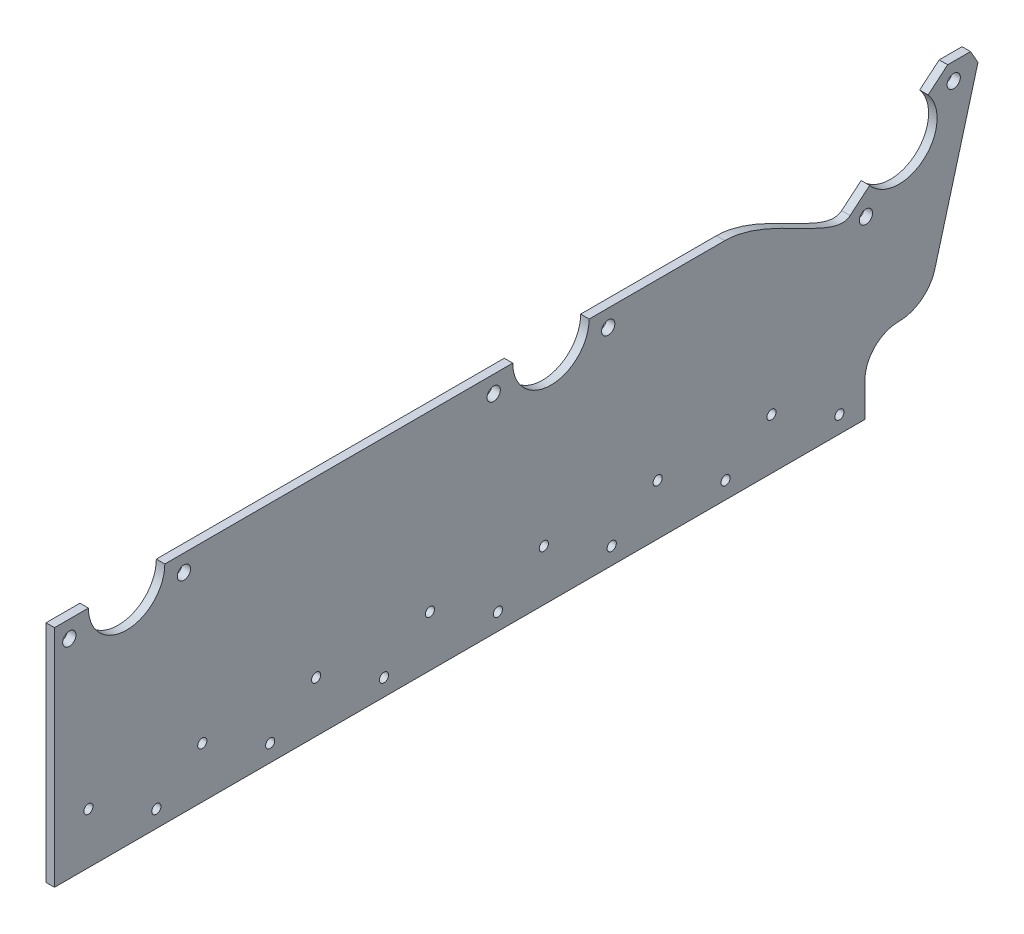
from build123d import *

# Parameters (mm, degrees)
BOSS_EXTRUDE1_DEPTH              = 3.175
F_10_CLEARANCE_HOLE1_D           = 4.9784
CHAMFER1_SIZE                    = 5.08
CHAMFER1_SIZE2                   = 4.134495326
F_1_8_0_135_DIAMETER_HOLE1_D     = 3.429
F_1_8_0_135_DIAMETER_HOLE1_DEPTH = 16.51
F_1_8_0_135_DIAMETER_HOLE1_TIP   = 1.030175531


with BuildPart() as part:
    # Sketch1 → Boss-Extrude1 (new body)
    with BuildSketch(Plane(origin=(0, 0, 0), x_dir=(0, 0, -1), z_dir=(1, 0, 0))):
        with BuildLine():
            Line((-12.7, -12.7), (-315.9125, -12.7))
            Line((-315.9125, -12.7), (-315.9125, 71.4375))
            Line((-315.9125, 71.4375), (-303.2125, 71.4375))
            ThreePointArc((-303.2125, 71.4375), (-288.925, 57.15), (-274.6375, 71.4375))
            Line((-274.6375, 71.4375), (-144.4625, 71.4375))
            ThreePointArc((-144.4625, 71.4375), (-130.175, 57.15), (-115.8875, 71.4375))
            Line((-115.8875, 71.4375), (-65.0875, 71.4375))
            add(Edge.make_bspline(
                [(-18.243165022, 56.129666959), (-24.729007974, 50.68739853), (-48.154166667, 71.4375), (-65.0875, 71.4375)],
                knots=[0, 0, 0, 0, 1, 1, 1, 1], degree=3))
            Line((-18.243165022, 56.129666959), (-10.944859981, 62.253672027))
            ThreePointArc((-10.944859981, 62.253672027), (9.183827973, 60.492640019), (10.944859981, 80.621327973))
            Line((10.944859981, 80.621327973), (18.243165022, 86.745333041))
            Line((18.243165022, 86.745333041), (30.943165022, 86.745333041))
            Line((30.943165022, 86.745333041), (13.473517024, 22.978761859))
            ThreePointArc((13.473517024, 22.978761859), (8.473319986, 15.563076555), (0, 12.7))
            ThreePointArc((0, 12.7), (-8.980256121, 8.980256121), (-12.7, 0))
            Line((-12.7, 0), (-12.7, -12.7))
        make_face()
    extrude(amount=BOSS_EXTRUDE1_DEPTH)

    # #10 Clearance Hole1 (through all)
    with Locations(Plane(origin=(3.175, 0, 0), x_dir=(0, 0, -1), z_dir=(1, 0, 0))):
        with Locations((-310.35625, 65.0875), (-267.49375, 65.0875), (-151.60625, 65.0875), (-108.74375, 65.0875), (-12.33558865, 52.797375826), (20.498991293, 80.348859746)):
            Hole(F_10_CLEARANCE_HOLE1_D / 2)

    # Chamfer1
    chamfer1_edges = [part.edges().sort_by_distance(p)[0] for p in [
        (1.5875, 86.745333041, -30.943165022),
    ]]
    chamfer1_side = [part.faces().sort_by_distance(p)[0] for p in [
        (1.5875, 54.86204745, -22.208341023),
    ]]
    chamfer(chamfer1_edges, length=CHAMFER1_SIZE, length2=CHAMFER1_SIZE2, reference=chamfer1_side[0])

    # 1/8 (0.135) Diameter Hole1
    with Locations(Plane(origin=(3.175, 0, 0), x_dir=(0, 0, -1), z_dir=(1, 0, 0))):
        with Locations((-22.2504, -6.35), (-47.6504, 6.35), (-64.844083333, -6.35), (-90.244083333, 6.35), (-107.437766667, -6.35), (-132.837766667, 6.35), (-150.03145, -6.35), (-175.43145, 6.35), (-192.625133333, -6.35), (-218.025133333, 6.35), (-235.218816667, -6.35), (-260.618816667, 6.35), (-277.8125, -6.35), (-303.2125, 6.35)):
            Hole(F_1_8_0_135_DIAMETER_HOLE1_D / 2, depth=F_1_8_0_135_DIAMETER_HOLE1_DEPTH)
            with Locations((0, 0, -(F_1_8_0_135_DIAMETER_HOLE1_DEPTH + F_1_8_0_135_DIAMETER_HOLE1_TIP / 2))):  # 118° drill point
                Cone(0, F_1_8_0_135_DIAMETER_HOLE1_D / 2, F_1_8_0_135_DIAMETER_HOLE1_TIP, mode=Mode.SUBTRACT)


solid = part.part
